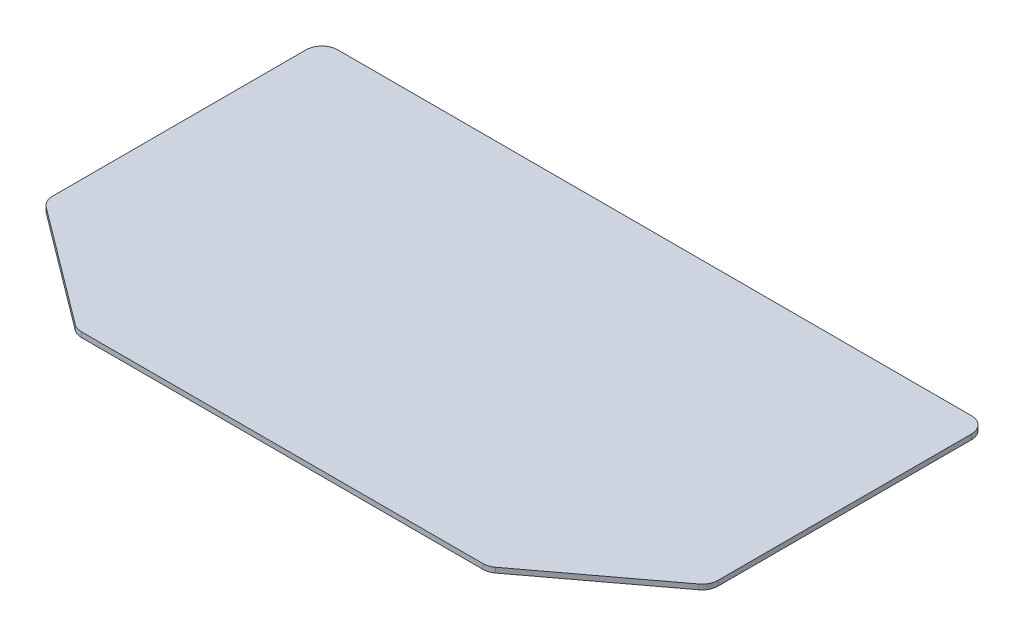
from build123d import *

# Parameters (mm, degrees)
BOSS_EXTRUDE1_DEPTH = 3.175
FILLET1_R           = 10


with BuildPart() as part:
    # Sketch1 → Boss-Extrude1 (new body)
    with BuildSketch(Plane(origin=(0, 0, 0), x_dir=(1, 0, 0), z_dir=(0, 1, 0))):
        Polygon((0, 235), (0, 60), (80, 0), (340, 0), (420, 60), (420, 235), align=None)
    extrude(amount=BOSS_EXTRUDE1_DEPTH)

    # Fillet1
    fillet1_edges = [part.edges().sort_by_distance(p)[0] for p in [
        (80, 1.5875, 0),
        (0, 1.5875, -60),
        (0, 1.5875, -235),
        (420, 1.5875, -235),
        (420, 1.5875, -60),
        (340, 1.5875, 0),
    ]]
    fillet(fillet1_edges, radius=FILLET1_R)


solid = part.part
